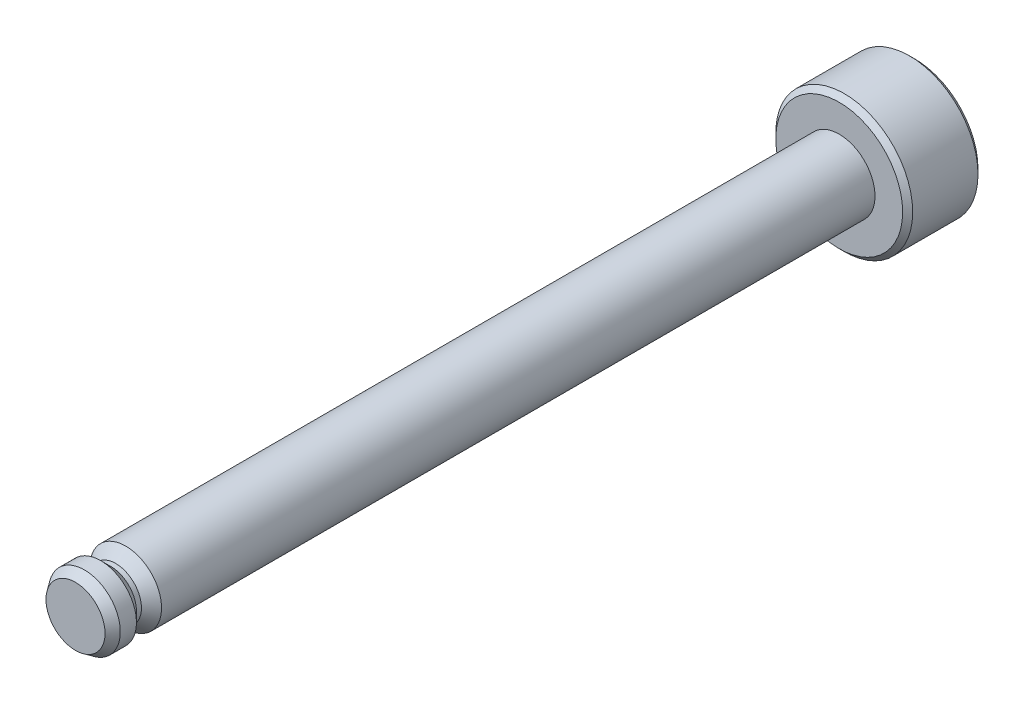
from build123d import *

# Parameters (mm, degrees)
SKETCH2_R      = 1.425
SHAFT_DEPTH    = 30.4
SKETCH5_R      = 2.725
HEAD_DEPTH     = 3
CHAMFER1_SIZE  = 0.25
CHAMFER1_SIZE2 = 0.357037002
DEBURS_SIZE    = 0.2


with BuildPart() as part:
    # Sketch2 → Shaft (new body)
    with BuildSketch(Plane.XY):
        Circle(SKETCH2_R)
    extrude(amount=SHAFT_DEPTH)

    # Sketch5 → Head (add)
    with BuildSketch(Plane.XY):
        Circle(SKETCH5_R)
    extrude(amount=-HEAD_DEPTH)

    # Chamfer1
    chamfer1_edges = [part.edges().sort_by_distance(p)[0] for p in [
        (-1.425, 0, 30.4),
    ]]
    chamfer1_side = [part.faces().sort_by_distance(p)[0] for p in [
        (0, 0, 30.4),
    ]]
    chamfer(chamfer1_edges, length=CHAMFER1_SIZE, length2=CHAMFER1_SIZE2, reference=chamfer1_side[0])

    # Deburs
    deburs_edges = [part.edges().sort_by_distance(p)[0] for p in [
        (-2.725, 0, 0),
        (-2.725, 0, -3),
    ]]
    chamfer(deburs_edges, length=DEBURS_SIZE)

    # Sketch6 → e-Clip Notch Long (revolve, cut)
    with BuildSketch(Plane(origin=(0, 0, 0), x_dir=(0, 0, -1), z_dir=(1, 0, 0))):
        Polygon((-29.4, 1.425), (-28.4, 1.425), (-28.8, 1.025), (-29, 1.025), align=None)
    revolve(axis=Axis((0, 0, 0), (0, 0, 1)), mode=Mode.SUBTRACT)


solid = part.part
